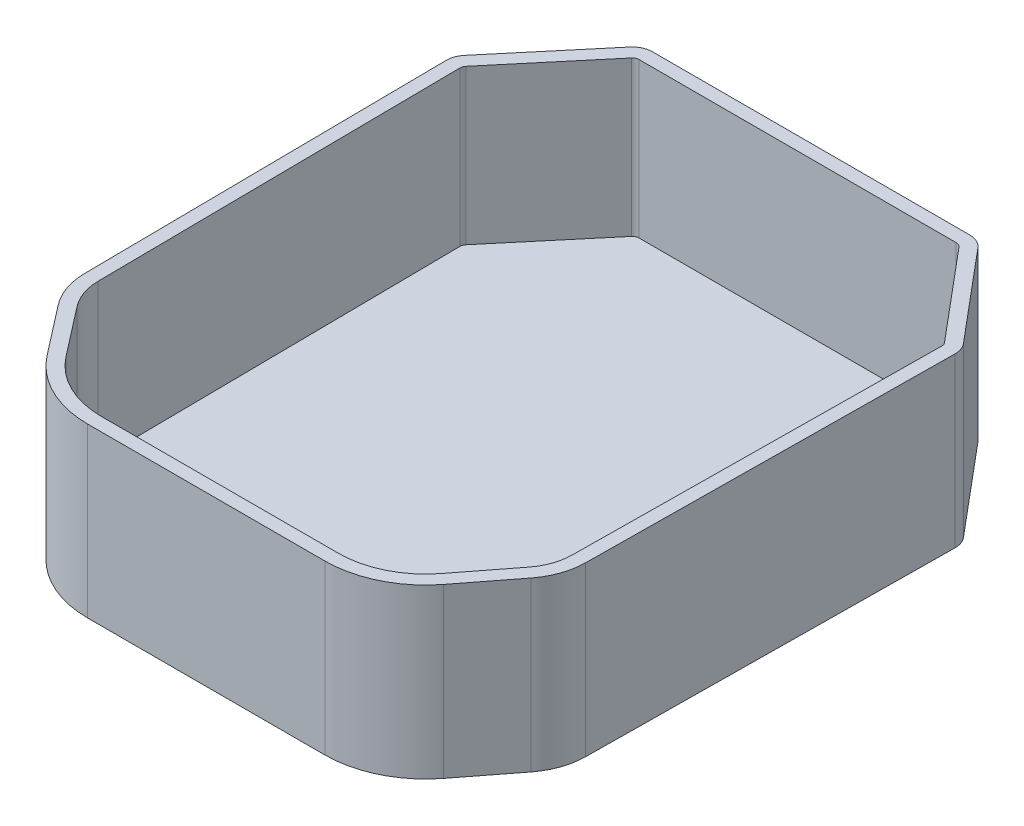
from build123d import *

# Parameters (mm, degrees)
AUFSATZ_LINEAR_AUSTRAGEN1_DEPTH = 25
VERRUNDUNG11_R                  = 15
VERRUNDUNG12_R                  = 10
VERRUNDUNG13_R                  = 3
VERRUNDUNG14_R                  = 3
WANDUNG4_T                      = -2


with BuildPart() as part:
    # Skizze1 → Aufsatz-Linear austragen1 (new body)
    with BuildSketch(Plane(origin=(0, 0, 0), x_dir=(1, 0, 0), z_dir=(0, 1, 0))):
        Polygon((0, -50.171355376), (-25, -50.171355376), (-37.244282987, -34.357515421), (-37.855752194, 24.507755761), (-25, 39.828644624), (0, 39.828644624), align=None)
    aufsatz_linear_austragen1 = extrude(amount=AUFSATZ_LINEAR_AUSTRAGEN1_DEPTH)

    # Spiegeln1: Aufsatz-Linear austragen1 across plane
    add(aufsatz_linear_austragen1.mirror(Plane(origin=(0, 0, 0), x_dir=(0, 0, 1), z_dir=(1, 0, 0))))

    # Verrundung11
    verrundung11_edges = [part.edges().sort_by_distance(p)[0] for p in [
        (-25, 12.5, 50.171355376),
        (25, 12.5, 50.171355376),
    ]]
    fillet(verrundung11_edges, radius=VERRUNDUNG11_R)

    # Verrundung12
    verrundung12_edges = [part.edges().sort_by_distance(p)[0] for p in [
        (37.244282987, 12.5, 34.357515421),
        (-37.244282987, 12.5, 34.357515421),
    ]]
    fillet(verrundung12_edges, radius=VERRUNDUNG12_R)

    # Verrundung13
    verrundung13_edges = [part.edges().sort_by_distance(p)[0] for p in [
        (-25, 12.5, -39.828644624),
        (25, 12.5, -39.828644624),
    ]]
    fillet(verrundung13_edges, radius=VERRUNDUNG13_R)

    # Verrundung14
    verrundung14_edges = [part.edges().sort_by_distance(p)[0] for p in [
        (37.855752194, 12.5, -24.507755761),
        (-37.855752194, 12.5, -24.507755761),
    ]]
    fillet(verrundung14_edges, radius=VERRUNDUNG14_R)

    # Wandung4
    wandung4_openings = [part.faces().sort_by_distance(p)[0] for p in [
        (0, 25, 4.917383245),
    ]]
    offset(amount=WANDUNG4_T, openings=wandung4_openings, kind=Kind.INTERSECTION)


solid = part.part
